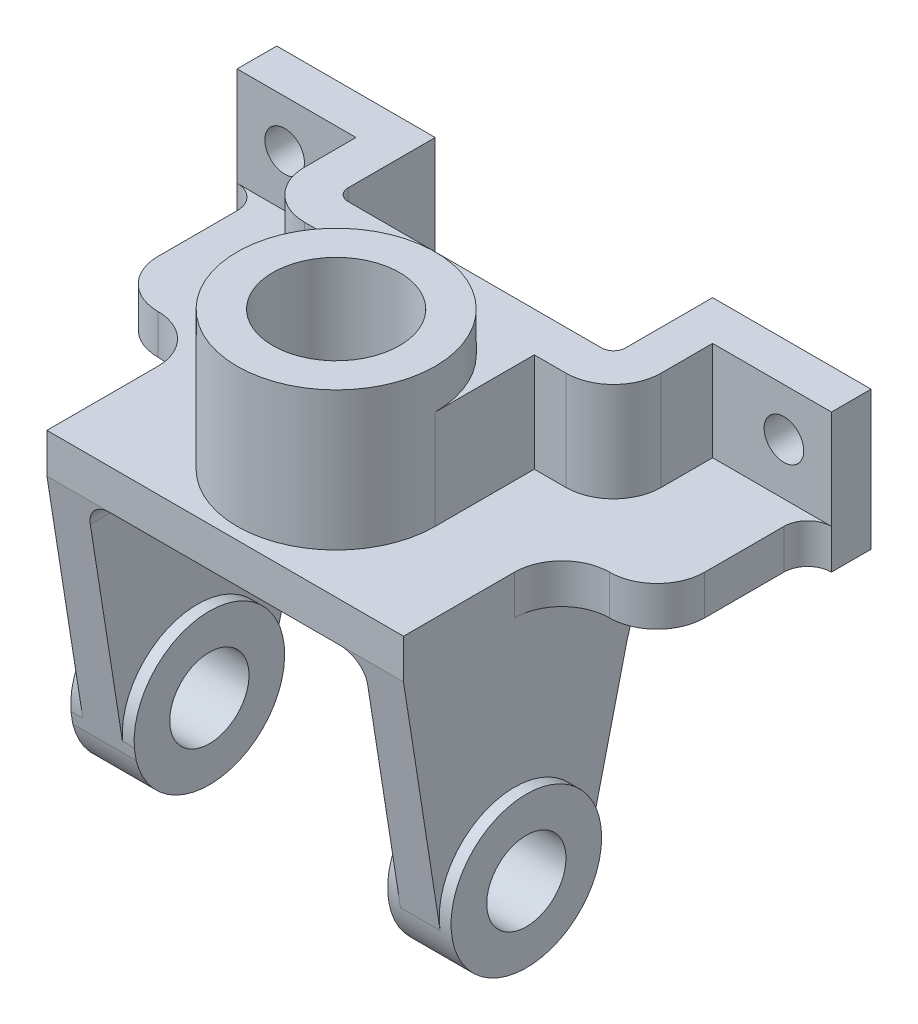
from build123d import *

# Parameters (mm, degrees)
BOSS_EXTRUDE1_DEPTH = 10
SKETCH2_R           = 25
SKETCH2_R_2         = 16
BOSS_EXTRUDE2_DEPTH = 35
BOSS_EXTRUDE4_START = -45
BOSS_EXTRUDE4_DEPTH = 35
SKETCH4_R           = 5
CUT_EXTRUDE1_DEPTH  = 35
FILLET1_R           = 12
FILLET2_R           = 12
BOSS_EXTRUDE5_START = -5
SKETCH5_R           = 19
SKETCH5_R_2         = 10
BOSS_EXTRUDE5_DEPTH = 8
BOSS_EXTRUDE6_DEPTH = 10
FILLET3_R           = 6
FILLET4_START       = 35
FILLET4_DEPTH       = 10
FILLET4_START_2     = -78
FILLET4_2_DEPTH     = 21.60438079
FILLET4_START_3     = 30.318225383
FILLET4_3_DEPTH     = 4.681774617
BOSS_EXTRUDE7_START = -5
SKETCH7_R           = 10
BOSS_EXTRUDE7_DEPTH = 8
BOSS_EXTRUDE8_START = -10
BOSS_EXTRUDE8_DEPTH = 10
FILLET5_R           = 6


with BuildPart() as part:
    # Sketch1 → Boss-Extrude1 (new body)
    with BuildSketch(Plane(origin=(0, 0, 0), x_dir=(1, 0, 0), z_dir=(0, 1, 0))):
        with BuildLine():
            Line((-45, 0), (45, 0))
            Line((45, 0), (45, 40))
            Line((45, 40), (69, 40))
            Line((69, 40), (69, 72))
            ThreePointArc((69, 72), (70.757359313, 76.242640687), (75, 78))
            Line((75, 78), (-75, 78))
            ThreePointArc((-75, 78), (-70.757359313, 76.242640687), (-69, 72))
            Line((-69, 72), (-69, 40))
            Line((-69, 40), (-45, 40))
            Line((-45, 40), (-45, 0))
        make_face()
    extrude(amount=-BOSS_EXTRUDE1_DEPTH)

    # Sketch2 → Boss-Extrude2 (add)
    with BuildSketch(Plane(origin=(0, 0, 0), x_dir=(1, 0, 0), z_dir=(0, 1, 0))):
        with Locations(Location((0, 28, 0), (0, 0, 270))):
            Circle(SKETCH2_R)
        with Locations(Location((0, 28, 0), (0, 0, 270))):
            Circle(SKETCH2_R_2, mode=Mode.SUBTRACT)
    extrude(amount=BOSS_EXTRUDE2_DEPTH)

    # Sketch3 → Boss-Extrude4 (add)
    with BuildSketch(Plane(origin=(0, 35, 0), x_dir=(1, 0, 0), z_dir=(0, 1, 0)).offset(BOSS_EXTRUDE4_START)):
        with BuildLine():
            Line((32, 63), (-32, 63))
            ThreePointArc((-32, 63), (-34.121320344, 63.878679656), (-35, 66))
            Line((-35, 66), (-35, 88))
            Line((-35, 88), (-75, 88))
            Line((-75, 88), (-75, 78))
            Line((-75, 78), (-45, 78))
            Line((-45, 78), (-45, 65))
            ThreePointArc((-45, 65), (-41.485281374, 56.514718626), (-33, 53))
            Line((-33, 53), (-25, 53))
            Line((-25, 53), (-25, 28))
            ThreePointArc((-25, 28), (0, 53), (25, 28))
            Line((25, 28), (25, 53))
            Line((25, 53), (33, 53))
            ThreePointArc((33, 53), (41.485281374, 56.514718626), (45, 65))
            Line((45, 65), (45, 78))
            Line((45, 78), (75, 78))
            Line((75, 78), (75, 88))
            Line((75, 88), (35, 88))
            Line((35, 88), (35, 66))
            ThreePointArc((35, 66), (34.121320344, 63.878679656), (32, 63))
        make_face()
    extrude(amount=BOSS_EXTRUDE4_DEPTH)

    # Sketch4 → Cut-Extrude1 (cut)
    with BuildSketch(Plane.XY.offset(-78)):
        with Locations((63, 13)):
            Circle(SKETCH4_R)
    cut_extrude1 = extrude(amount=-CUT_EXTRUDE1_DEPTH, mode=Mode.SUBTRACT)

    # Mirror1: Cut-Extrude1 across plane
    add(cut_extrude1.mirror(Plane(origin=(0, 0, 0), x_dir=(0, 0, 1), z_dir=(1, 0, 0))), mode=Mode.SUBTRACT)

    # Fillet1
    fillet1_edges = [part.edges().sort_by_distance(p)[0] for p in [
        (-45, -5, -40),
        (45, -5, -40),
    ]]
    fillet(fillet1_edges, radius=FILLET1_R)

    # Fillet2
    fillet2_edges = [part.edges().sort_by_distance(p)[0] for p in [
        (-69, -5, -40),
        (69, -5, -40),
    ]]
    fillet(fillet2_edges, radius=FILLET2_R - 0.0001)  # a hair under: the kernel refuses the full size



with BuildPart() as body_2:
    # Sketch5 → Boss-Extrude5 (new, symmetric)
    with BuildSketch(Plane(origin=(45, 0, 0), x_dir=(0, 0, -1), z_dir=(1, 0, 0)).offset(BOSS_EXTRUDE5_START)):
        with Locations((28, -66)):
            Circle(SKETCH5_R)
        with Locations((28, -66)):
            Circle(SKETCH5_R_2, mode=Mode.SUBTRACT)
    extrude(amount=BOSS_EXTRUDE5_DEPTH, both=True)


with BuildPart() as part_1:
    add(part.part)

    add(body_2.part)  # Boss-Extrude6 merges body 2
    # Sketch5<3> → Boss-Extrude6 (add)
    with BuildSketch(Plane(origin=(45, 0, 0), x_dir=(0, 0, -1), z_dir=(1, 0, 0))):
        with BuildLine():
            Line((61, -10), (0, -10))
            Line((0, -10), (9.228717941, -68.939212458))
            ThreePointArc((9.228717941, -68.939212458), (26.525951004, -47.057265785), (47, -66))
            ThreePointArc((47, -66), (46.868026287, -68.235527685), (46.473938523, -70.439999487))
            Line((46.473938523, -70.439999487), (61, -10))
        make_face()
    extrude(amount=-BOSS_EXTRUDE6_DEPTH)

    # Fillet3
    fillet3_edges = [part_1.edges().sort_by_distance(p)[0] for p in [
        (35, -10, -30.5),
    ]]
    fillet(fillet3_edges, radius=FILLET3_R)

    # Fillet4: read off the stored shape, not the designer's step
    # Fillet4 outline → Fillet4 (add)
    with BuildSketch(Plane.YZ.offset(FILLET4_START)):
        with BuildLine():
            ThreePointArc((-29.157895412, -56.39561931), (-15.365176157, -65.228495591), (-10, -80.703433157))
            Line((-10, -80.703433157), (-10, -61))
            Line((-10, -61), (-29.157895412, -56.39561931))
        make_face()
    extrude(amount=FILLET4_DEPTH)

    # Fillet4 2 outline → Fillet4 2 (add)
    with BuildSketch(Plane.XY.offset(FILLET4_START_2)):
        with BuildLine():
            ThreePointArc((29, -10), (33.242640687, -11.757359313), (35, -16))
            Line((35, -16), (35, -10))
            Line((35, -10), (29, -10))
        make_face()
    extrude(amount=FILLET4_2_DEPTH)

    # Fillet4 3 outline → Fillet4 3 (cut)
    with BuildSketch(Plane.YZ.offset(FILLET4_START_3)):
        with BuildLine():
            Line((-18, -80), (-10.009898324, -80))
            ThreePointArc((-10.009898324, -80), (-12.047126523, -70.795577731), (-17.3481317, -63))
            Line((-17.3481317, -63), (-18, -63))
            Line((-18, -63), (-18, -80))
        make_face()
    extrude(amount=FILLET4_3_DEPTH, mode=Mode.SUBTRACT)



with BuildPart() as body_2_2:
    # Sketch7 → Boss-Extrude7 (new, symmetric)
    with BuildSketch(Plane.ZY.offset(45).offset(BOSS_EXTRUDE7_START)):
        with BuildLine():
            ThreePointArc((-46.473938523, -70.439999487), (-28, -85), (-9.526061477, -70.439999487))
            Line((-9.526061477, -70.439999487), (-9.055986357, -67.457514009))
            ThreePointArc((-9.055986357, -67.457514009), (-9.014001748, -66.729294447), (-9, -66))
            ThreePointArc((-9, -66), (-30.235527685, -47.131973713), (-46.473938523, -70.439999487))
        make_face()
        with Locations(Location((-28, -66, 0), (0, 0, 180))):
            Circle(SKETCH7_R, mode=Mode.SUBTRACT)
    extrude(amount=BOSS_EXTRUDE7_DEPTH, both=True)


with BuildPart() as part_2:
    add(part_1.part)

    add(body_2_2.part)  # Boss-Extrude8 merges body 2 2
    # Sketch7<3> → Boss-Extrude8 (add)
    with BuildSketch(Plane.ZY.offset(45).offset(BOSS_EXTRUDE8_START)):
        with BuildLine():
            ThreePointArc((-9, -66), (-9.014001748, -66.729294447), (-9.055986357, -67.457514009))
            Line((-9.055986357, -67.457514009), (0, -10))
            Line((0, -10), (-28, -10))
            Line((-28, -10), (-78, -10))
            Line((-78, -10), (-70.785998867, -12.051263714))
            Line((-70.785998867, -12.051263714), (-64.455356347, -16))
            Line((-64.455356347, -16), (-59.38495245, -21.941578182))
            Line((-59.38495245, -21.941578182), (-56.39561931, -29.157895412))
            Line((-56.39561931, -29.157895412), (-46.473938523, -70.439999487))
            ThreePointArc((-46.473938523, -70.439999487), (-30.235527685, -47.131973713), (-9, -66))
        make_face()
    extrude(amount=BOSS_EXTRUDE8_DEPTH)

    # Fillet5
    # the kernel refuses this fillet: 6 mm, written as the material it adds along each edge
    with BuildSketch(Plane(origin=(-35, -10, 0), x_dir=(1, 0, 0), z_dir=(0, 0, -1))) as fillet5_piece_1_section:
        with BuildLine():
            CenterArc((FILLET5_R, FILLET5_R), FILLET5_R, 180, 90)
            Line((0, FILLET5_R), (0, 0))
            Line((0, 0), (FILLET5_R, 0))
        make_face()
    fillet5_piece_1 = extrude(amount=78, mode=Mode.PRIVATE)
    fillet5_piece_1 = split(fillet5_piece_1, bisect_by=Plane(origin=(-35, -10, 0), z_dir=(0, 0.15568994877172856, -0.9878059727757555)), keep=Keep.TOP, mode=Mode.PRIVATE)
    fillet5_piece_1 = split(fillet5_piece_1, bisect_by=Plane(origin=(-35, -30.519826172, -5.834705883), z_dir=(0, 0.9618711340013946, 0.27350305587848817)), keep=Keep.TOP, mode=Mode.PRIVATE)
    fillet5_piece_1 = split(fillet5_piece_1, bisect_by=Plane(origin=(-35, -44.355068521, -40.257803859), z_dir=(0, 0.6491383227373216, 0.7606703871939389)), keep=Keep.TOP, mode=Mode.PRIVATE)
    add(fillet5_piece_1)
    with BuildSketch(Plane(origin=(-35, -10, 0), x_dir=(1, 0, 0), z_dir=(0, 0, -1))) as fillet5_piece_2_section:
        with BuildLine():
            CenterArc((FILLET5_R, FILLET5_R), FILLET5_R, 180, 90)
            Line((0, FILLET5_R), (0, 0))
            Line((0, 0), (FILLET5_R, 0))
        make_face()
    fillet5_piece_2 = extrude(amount=78, mode=Mode.PRIVATE)
    fillet5_piece_2 = split(fillet5_piece_2, bisect_by=Plane(origin=(-35, -30.519826172, -5.834705883), z_dir=(0, -0.9618711340013946, -0.27350305587848817)), keep=Keep.TOP, mode=Mode.PRIVATE)
    fillet5_piece_2 = split(fillet5_piece_2, bisect_by=Plane(origin=(-35, -44.355068521, -40.257803859), z_dir=(0, 0.6491383227373216, 0.7606703871939389)), keep=Keep.TOP, mode=Mode.PRIVATE)
    add(fillet5_piece_2)
    with BuildSketch(Plane(origin=(-35, -10, 0), x_dir=(1, 0, 0), z_dir=(0, 0, -1))) as fillet5_piece_3_section:
        with BuildLine():
            CenterArc((FILLET5_R, FILLET5_R), FILLET5_R, 180, 90)
            Line((0, FILLET5_R), (0, 0))
            Line((0, 0), (FILLET5_R, 0))
        make_face()
    fillet5_piece_3 = extrude(amount=78, mode=Mode.PRIVATE)
    fillet5_piece_3 = split(fillet5_piece_3, bisect_by=Plane(origin=(-35, -30.519826172, -5.834705883), z_dir=(0, 0.9618711340013946, 0.27350305587848817)), keep=Keep.TOP, mode=Mode.PRIVATE)
    fillet5_piece_3 = split(fillet5_piece_3, bisect_by=Plane(origin=(-35, -43.262700092, -20.747598748), z_dir=(0, 0.8484747516990396, 0.5292358602071983)), keep=Keep.TOP, mode=Mode.PRIVATE)
    fillet5_piece_3 = split(fillet5_piece_3, bisect_by=Plane(origin=(-35, -44.355068521, -40.257803859), z_dir=(0, -0.6491383227373216, -0.7606703871939389)), keep=Keep.TOP, mode=Mode.PRIVATE)
    add(fillet5_piece_3)
    with BuildSketch(Plane(origin=(-35, -10, 0), x_dir=(1, 0, 0), z_dir=(0, 0, -1))) as fillet5_piece_4_section:
        with BuildLine():
            CenterArc((FILLET5_R, FILLET5_R), FILLET5_R, 180, 90)
            Line((0, FILLET5_R), (0, 0))
            Line((0, 0), (FILLET5_R, 0))
        make_face()
    fillet5_piece_4 = extrude(amount=78, mode=Mode.PRIVATE)
    fillet5_piece_4 = split(fillet5_piece_4, bisect_by=Plane(origin=(-35, -30.519826172, -5.834705883), z_dir=(0, -0.9618711340013946, -0.27350305587848817)), keep=Keep.TOP, mode=Mode.PRIVATE)
    fillet5_piece_4 = split(fillet5_piece_4, bisect_by=Plane(origin=(-35, -43.262700092, -20.747598748), z_dir=(0, 0.8484747516990396, 0.5292358602071983)), keep=Keep.TOP, mode=Mode.PRIVATE)
    fillet5_piece_4 = split(fillet5_piece_4, bisect_by=Plane(origin=(-35, -44.355068521, -40.257803859), z_dir=(0, -0.6491383227373216, -0.7606703871939389)), keep=Keep.TOP, mode=Mode.PRIVATE)
    add(fillet5_piece_4)
    with BuildSketch(Plane(origin=(-35, -10, 0), x_dir=(1, 0, 0), z_dir=(0, 0, -1))) as fillet5_piece_5_section:
        with BuildLine():
            CenterArc((FILLET5_R, FILLET5_R), FILLET5_R, 180, 90)
            Line((0, FILLET5_R), (0, 0))
            Line((0, 0), (FILLET5_R, 0))
        make_face()
    fillet5_piece_5 = extrude(amount=78, mode=Mode.PRIVATE)
    fillet5_piece_5 = split(fillet5_piece_5, bisect_by=Plane(origin=(-35, -30.519826172, -5.834705883), z_dir=(0, 0.9618711340013946, 0.27350305587848817)), keep=Keep.TOP, mode=Mode.PRIVATE)
    fillet5_piece_5 = split(fillet5_piece_5, bisect_by=Plane(origin=(-35, -43.262700092, -20.747598748), z_dir=(0, -0.8484747516990396, -0.5292358602071983)), keep=Keep.TOP, mode=Mode.PRIVATE)
    add(fillet5_piece_5)


solid = part_2.part
